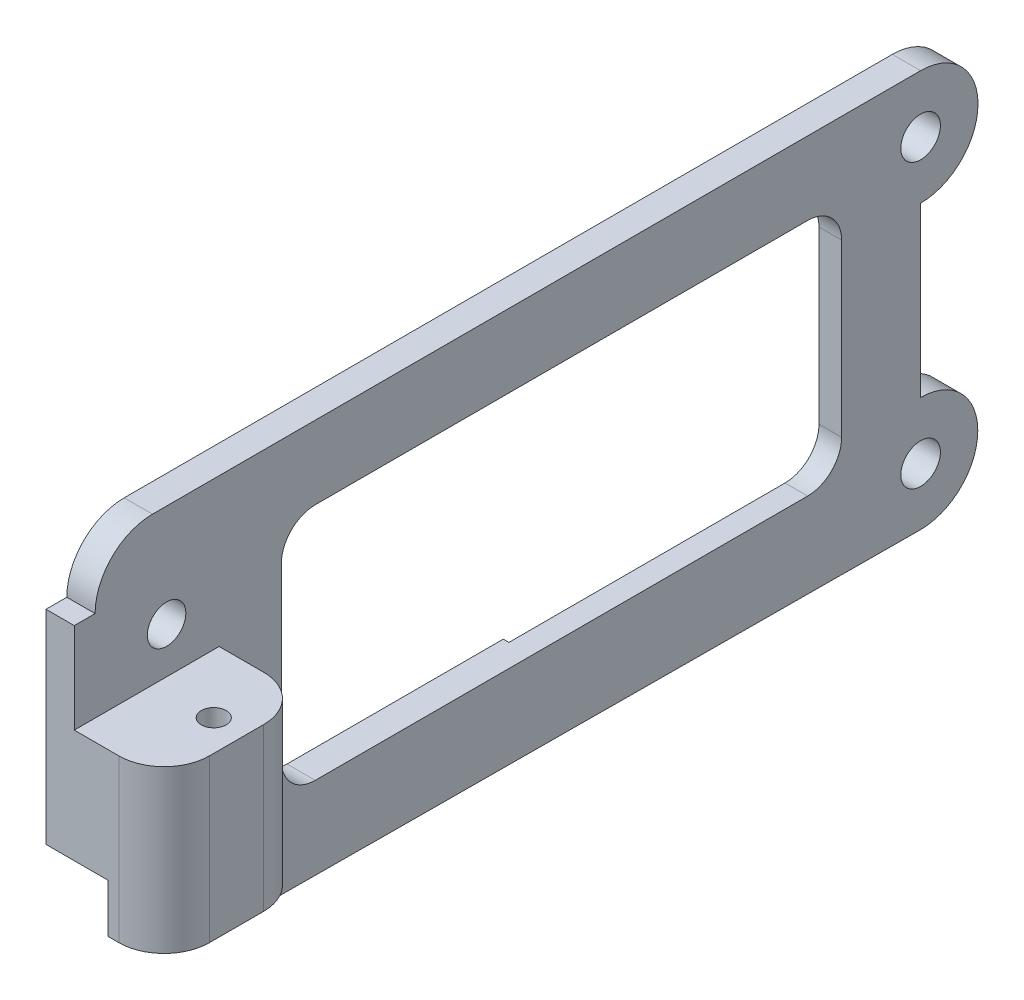
from build123d import *

# Parameters (mm, degrees)
SKETCH1_W           = 30
SKETCH1_H           = 20
BOSS_EXTRUDE1_DEPTH = 2
SKETCH2_W           = 30
SKETCH2_H           = 20
SKETCH2_R           = 1.75
BOSS_EXTRUDE2_DEPTH = 2.5
SKETCH5_W           = 12.800974789
SKETCH5_H           = 10
BOSS_EXTRUDE3_DEPTH = 7.942853576
SKETCH6_R           = 1.1
CUT_EXTRUDE3_DEPTH  = 10.350916352
CUT_EXTRUDE4_DEPTH  = 10
BOSS_EXTRUDE4_START = 4.3
SKETCH8_W           = 4.957735271
SKETCH8_H           = 12.800974789
SKETCH8_R           = 1.1
BOSS_EXTRUDE4_DEPTH = 4.3
FILLET2_R           = 4
SKETCH9_R           = 1.7
CUT_EXTRUDE5_DEPTH  = 5


with BuildPart() as part:
    # Sketch1 → Boss-Extrude1 (new body)
    with BuildSketch(Plane(origin=(0, 0, 0), x_dir=(0, 0, -1), z_dir=(1, 0, 0))):
        Rectangle(SKETCH1_W, SKETCH1_H)
    extrude(amount=BOSS_EXTRUDE1_DEPTH)

    # Sketch2 → Boss-Extrude2 (add)
    with BuildSketch(Plane(origin=(2, 0, 0), x_dir=(0, 0, -1), z_dir=(1, 0, 0))):
        with BuildLine():
            Line((19.386302525, -6.596950759), (19.386302525, 8.271904581))
            ThreePointArc((19.386302525, 8.271904581), (24.460347107, 13.345949163), (19.386302525, 18.419993745))
            Line((19.386302525, 18.419993745), (-48.501605412, 18.419993745))
            ThreePointArc((-48.501605412, 18.419993745), (-52.089496744, 16.933840495), (-53.575649994, 13.345949163))
            Line((-53.575649994, 13.345949163), (-55.414672264, 13.345949163))
            Line((-55.414672264, 13.345949163), (-55.414672264, -4.656096182))
            Line((-55.414672264, -4.656096182), (-41.753395036, -4.656096182))
            Line((-41.753395036, -4.656096182), (-41.329654068, -16.384050837))
            Line((-41.329654068, -16.384050837), (19.386302525, -16.711150914))
            ThreePointArc((19.386302525, -16.711150914), (24.443402602, -11.654050837), (19.386302525, -6.596950759))
        make_face()
        Rectangle(SKETCH2_W, SKETCH2_H, mode=Mode.SUBTRACT)
        with Locations((19.386302525, -11.654050837)):
            Circle(SKETCH2_R, mode=Mode.SUBTRACT)
        with Locations((19.386302525, 13.345949163)):
            Circle(SKETCH2_R, mode=Mode.SUBTRACT)
    extrude(amount=-BOSS_EXTRUDE2_DEPTH)

    # Sketch5 → Boss-Extrude3 (add)
    with BuildSketch(Plane(origin=(2, 0, 0), x_dir=(0, 0, -1), z_dir=(1, 0, 0))):
        with Locations((-49.014184869, 0.343903818)):
            Rectangle(SKETCH5_W, SKETCH5_H)
    extrude(amount=BOSS_EXTRUDE3_DEPTH)

    # Sketch6 → Cut-Extrude3 (cut)
    with BuildSketch(Plane(origin=(4.063003727, -4.656096182, -0.641169076), x_dir=(1, 0, 0), z_dir=(0, -1, 0))):
        with Locations((3.15, 48.941437628)):
            Circle(SKETCH6_R)
    extrude(amount=-CUT_EXTRUDE3_DEPTH, mode=Mode.SUBTRACT)

    # Sketch7 → Cut-Extrude4 (cut)
    with BuildSketch(Plane(origin=(2, 0, 0), x_dir=(0, 0, -1), z_dir=(1, 0, 0))):
        with BuildLine():
            Line((-34.112632424, 11.943731273), (9.404530778, 11.943731273))
            ThreePointArc((9.404530778, 11.943731273), (11.525851122, 11.065051617), (12.404530778, 8.943731273))
            Line((12.404530778, 8.943731273), (12.404530778, -6.148588701))
            ThreePointArc((12.404530778, -6.148588701), (11.525851122, -8.269909045), (9.404530778, -9.148588701))
            Line((9.404530778, -9.148588701), (-34.112632424, -9.148588701))
            ThreePointArc((-34.112632424, -9.148588701), (-36.233952768, -8.269909045), (-37.112632424, -6.148588701))
            Line((-37.112632424, -6.148588701), (-37.112632424, 8.943731273))
            ThreePointArc((-37.112632424, 8.943731273), (-36.233952768, 11.065051617), (-34.112632424, 11.943731273))
        make_face()
    extrude(amount=-CUT_EXTRUDE4_DEPTH, mode=Mode.SUBTRACT)

    # Sketch8 → Boss-Extrude4 (add)
    with BuildSketch(Plane.XZ.offset(4.656096182).offset(BOSS_EXTRUDE4_START)):
        with Locations((7.463985941, 49.014184869)):
            Rectangle(SKETCH8_W, SKETCH8_H)
        with Locations((7.213003727, 48.300268552)):
            Circle(SKETCH8_R, mode=Mode.SUBTRACT)
    extrude(amount=-BOSS_EXTRUDE4_DEPTH)

    # Fillet2
    fillet2_edges = [part.edges().sort_by_distance(p)[0] for p in [
        (9.942853576, -1.806096182, 42.613697475),
        (9.942853576, -1.806096182, 55.414672264),
    ]]
    fillet(fillet2_edges, radius=FILLET2_R)

    # Sketch9 → Cut-Extrude5 (cut)
    with BuildSketch(Plane(origin=(2, 0, 0), x_dir=(0, 0, -1), z_dir=(1, 0, 0))):
        with Locations((-47.255689875, 9.377983735)):
            Circle(SKETCH9_R)
    extrude(amount=-CUT_EXTRUDE5_DEPTH, mode=Mode.SUBTRACT)


solid = part.part
